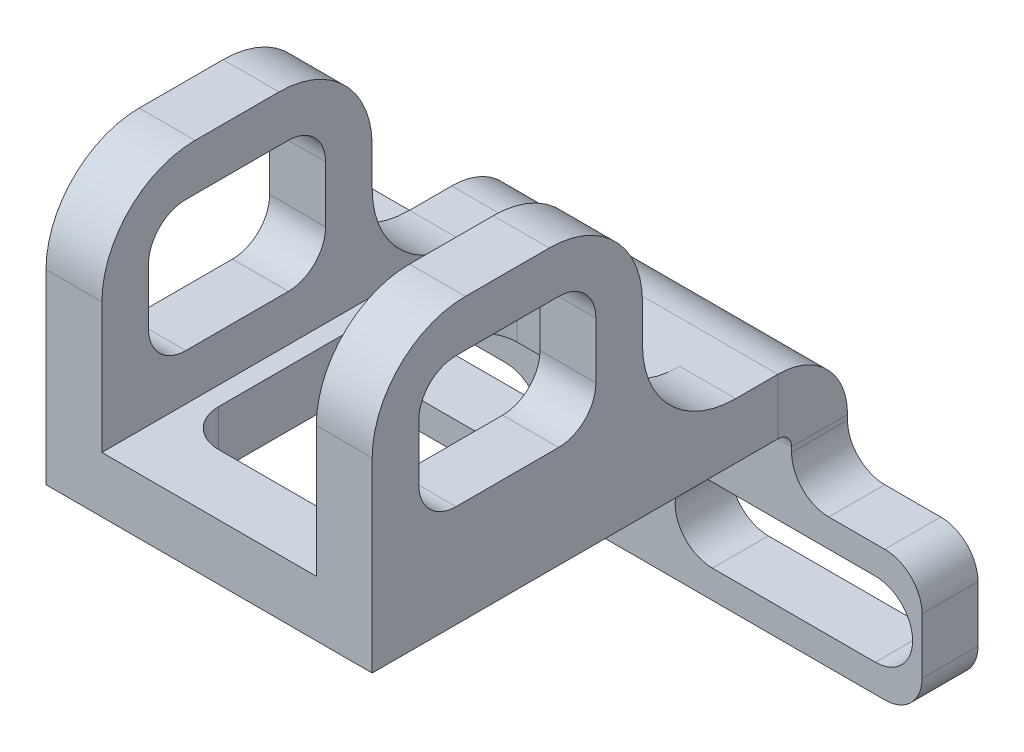
from build123d import *

# Parameters (mm, degrees)
FLANGE_BASE1_DEPTH             = 3
CORTE_EXTRUS_O1_DEPTH          = 3
ARESTA_FLANGE4_STRIP_W         = 13.4732
ARESTA_FLANGE4_STRIP_H         = 3
ARESTA_FLANGE4_STRIP_CUT_DEPTH = 17.5
ARESTA_FLANGE4_DEPTH           = 17.5
ESBO_O47_W                     = 14.5
ESBO_O47_H                     = 15
RESSALTO_EXTRUS_O1_DEPTH       = 3
FILETE1_R                      = 5
ESBO_O48_W                     = 14.5
ESBO_O48_H                     = 15
RESSALTO_EXTRUS_O2_DEPTH       = 3
FILETE2_R                      = 5
FILETE3_R                      = 2
CORTE_EXTRUS_O5_DEPTH          = 42.11835661
CORTE_EXTRUS_O6_DEPTH          = 3


# Sheet-metal steps are written as plain solids
with BuildPart() as part:
    # Esboço1 → Flange-base1 (new body)
    with BuildSketch(Plane.XY):
        Polygon((-14.370772566, 2.693459119), (-4.370772566, 2.693459119), (-4.370772566, 5.693459119), (13.129227434, 5.693459119), (13.129227434, 2.693459119), (20.129227434, 2.693459119), (20.129227434, -4.306540881), (-14.370772566, -4.306540881), align=None)
    extrude(amount=-FLANGE_BASE1_DEPTH)

    # Esboço8 → Corte-extrusão1 (cut)
    with BuildSketch(Plane.XY):
        with BuildLine():
            Line((-10.260200759, 1.193459119), (-2.260200759, 1.193459119))
            ThreePointArc((-2.260200759, 1.193459119), (-0.260200759, -0.806540881), (-2.260200759, -2.806540881))
            Line((-2.260200759, -2.806540881), (-10.260200759, -2.806540881))
            ThreePointArc((-10.260200759, -2.806540881), (-12.260200759, -0.806540881), (-10.260200759, 1.193459119))
        make_face()
        with BuildLine():
            Line((8.88097681, 1.193459119), (17.620096532, 1.193459119))
            ThreePointArc((17.620096532, 1.193459119), (19.620096532, -0.806540881), (17.620096532, -2.806540881))
            Line((17.620096532, -2.806540881), (8.88097681, -2.806540881))
            ThreePointArc((8.88097681, -2.806540881), (6.88097681, -0.806540881), (8.88097681, 1.193459119))
        make_face()
    extrude(amount=-CORTE_EXTRUS_O1_DEPTH, mode=Mode.SUBTRACT)

    # Aresta-Flange4 strip (across the edge) → Aresta-Flange4 strip cut (cut)
    with BuildSketch(Plane(origin=(13.129227434, 5.693459119, 0), x_dir=(0, -1, 0), z_dir=(-1, 0, 0))):
        with Locations((-6, -1.5)):
            Rectangle(ARESTA_FLANGE4_STRIP_W, ARESTA_FLANGE4_STRIP_H)
    extrude(amount=ARESTA_FLANGE4_STRIP_CUT_DEPTH, mode=Mode.SUBTRACT)

    # Aresta-Flange4 section (across the edge) → Aresta-Flange4 (add)
    with BuildSketch(Plane(origin=(13.129227434, 5.693459119, 0), x_dir=(0, -1, 0), z_dir=(-1, 0, 0))):
        with BuildLine():
            Line((-3, 0.7366), (-3, 22.5))
            Line((-3, 22.5), (0, 22.5))
            Line((0, 22.5), (0, 0.7366))
            ThreePointArc((0, 0.7366), (0.215745145, 0.215745145), (0.7366, 0))
            Line((0.7366, 0), (0.7366, -3))
            ThreePointArc((0.7366, -3), (-1.905575199, -1.905575199), (-3, 0.7366))
        make_face()
    extrude(amount=ARESTA_FLANGE4_DEPTH)

    # Esboço47 → Ressalto-extrusão1 (add)
    with BuildSketch(Plane(origin=(13.129227434, 0, 0), x_dir=(0, 0, -1), z_dir=(1, 0, 0))):
        with Locations((-15.25, 13.193459119)):
            Rectangle(ESBO_O47_W, ESBO_O47_H)
    extrude(amount=-RESSALTO_EXTRUS_O1_DEPTH)

    # Filete1
    filete1_edges = [part.edges().sort_by_distance(p)[0] for p in [
        (11.629227434, 20.693459119, 22.5),
        (11.629227434, 8.693459119, 8),
        (11.629227434, 20.693459119, 8),
    ]]
    fillet(filete1_edges, radius=FILETE1_R)

    # Esboço48 → Ressalto-extrusão2 (add)
    with BuildSketch(Plane.ZY.offset(4.370772566)):
        with Locations((15.25, 13.193459119)):
            Rectangle(ESBO_O48_W, ESBO_O48_H)
    extrude(amount=-RESSALTO_EXTRUS_O2_DEPTH)

    # Filete2
    filete2_edges = [part.edges().sort_by_distance(p)[0] for p in [
        (-2.870772566, 20.693459119, 22.5),
        (-2.870772566, 8.693459119, 8),
        (-2.870772566, 20.693459119, 8),
    ]]
    fillet(filete2_edges, radius=FILETE2_R)

    # Filete3
    filete3_edges = [part.edges().sort_by_distance(p)[0] for p in [
        (20.129227434, -4.306540881, -1.5),
        (-14.370772566, -4.306540881, -1.5),
        (-14.370772566, 2.693459119, -1.5),
        (-4.370772566, 2.693459119, -1.5),
        (13.129227434, 2.693459119, -1.5),
        (20.129227434, 2.693459119, -1.5),
    ]]
    fillet(filete3_edges, radius=FILETE3_R)

    # Esboço49 → Corte-extrusão5 (cut, through all)
    with BuildSketch(Plane(origin=(13.129227434, 0, 0), x_dir=(0, 0, -1), z_dir=(1, 0, 0))):
        with BuildLine():
            Line((-18, 11.175198381), (-12.5, 11.175198381))
            ThreePointArc((-12.5, 11.175198381), (-11.085786438, 11.760984819), (-10.5, 13.175198381))
            Line((-10.5, 13.175198381), (-10.5, 16.193459119))
            ThreePointArc((-10.5, 16.193459119), (-11.085786438, 17.607672682), (-12.5, 18.193459119))
            Line((-12.5, 18.193459119), (-18, 18.193459119))
            ThreePointArc((-18, 18.193459119), (-19.414213562, 17.607672682), (-20, 16.193459119))
            Line((-20, 16.193459119), (-20, 13.175198381))
            ThreePointArc((-20, 13.175198381), (-19.414213562, 11.760984819), (-18, 11.175198381))
        make_face()
    extrude(amount=-CORTE_EXTRUS_O5_DEPTH, mode=Mode.SUBTRACT)

    # Esboço50 → Corte-extrusão6 (cut)
    with BuildSketch(Plane.XZ.offset(-5.693459119)):
        with BuildLine():
            Line((1.629227434, 19.2366), (7.129227434, 19.2366))
            ThreePointArc((7.129227434, 19.2366), (8.543440996, 18.650813562), (9.129227434, 17.2366))
            Line((9.129227434, 17.2366), (9.129227434, 5.2366))
            ThreePointArc((9.129227434, 5.2366), (8.543440996, 3.822386438), (7.129227434, 3.2366))
            Line((7.129227434, 3.2366), (1.629227434, 3.2366))
            ThreePointArc((1.629227434, 3.2366), (0.215013871, 3.822386438), (-0.370772566, 5.2366))
            Line((-0.370772566, 5.2366), (-0.370772566, 17.2366))
            ThreePointArc((-0.370772566, 17.2366), (0.215013871, 18.650813562), (1.629227434, 19.2366))
        make_face()
    extrude(amount=-CORTE_EXTRUS_O6_DEPTH, mode=Mode.SUBTRACT)


solid = part.part
